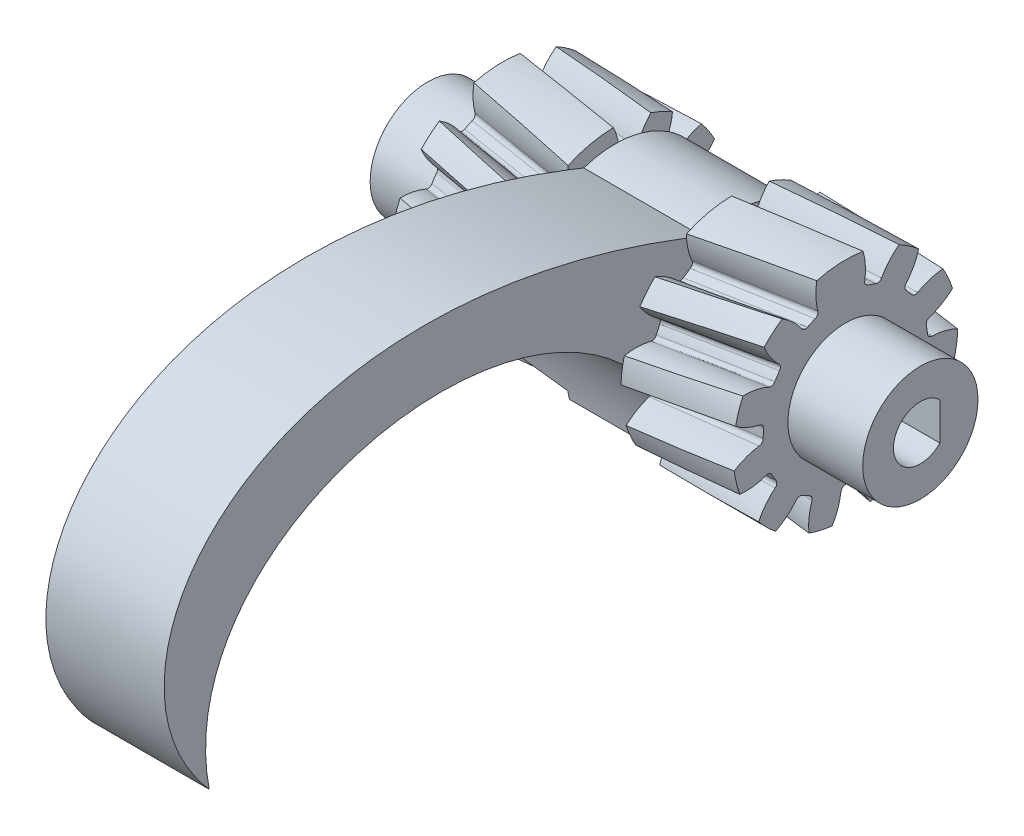
from build123d import *
from build123d.topology import SkipClean

# Parameters (mm, degrees)
CLAWSHAPE_DEPTH             = 3.75
GEARFILLET_R                = 0.3
GEARPATTERN_COUNT           = 11
GEARPATTERN_ANGLE           = 316.66666666700075
GEARFILLET_OF_GEARPATTERN_R = 0.3
SKETCH8_R                   = 3.85
BOSS_EXTRUDE1_DEPTH         = 5
BOSS_EXTRUDE2_DEPTH         = 3.95
CUT_EXTRUDE1_DEPTH          = 10
CUT_EXTRUDE1_DEPTH_BACK     = 49.25610305721891
CUT_EXTRUDE2_REACH          = 46.344


with BuildPart() as part:
    # Sketch1 → ClawShape (new, symmetric)
    with BuildSketch(Plane(origin=(0, 0, 0), x_dir=(0, 0, -1), z_dir=(1, 0, 0))):
        with BuildLine():
            ThreePointArc((-2.4038461538461515, 7.1043313315638), (-7.40042177807213, -1.218095852811159), (-1.38e-15, -7.500000000000001))
            ThreePointArc((0, -7.500000000000001), (5.303300858899106, -5.303300858899107), (7.499999999999999, -2.12e-15))
            ThreePointArc((7.499999999999999, -4.6e-16), (4.371564585257427, 6.094212260573391), (-2.4038461538461506, 7.104331331563799))
        make_face()
    extrude(amount=CLAWSHAPE_DEPTH, both=True)

    # Sketch6 for GearCut → GearCut section 0
    with BuildSketch(Plane(origin=(-3.75, 0, 0), x_dir=(0, -0.3216136511067725, -0.9468709835145288), z_dir=(1, 0, 0))):
        with BuildLine():
            # circular arc as an exact rational Bezier (weights 1, cos(half-angle), 1)
            Bezier((-0.5585419946678365, 5.471565666259748), (-0.732431488, 7.175014626), (-2.069978418155151, 8.244100275249684), weights=[1, 0.922077909565, 1])
            Bezier((-2.069978418155151, 8.244100275249684), (0, 8.763842941), (2.069978418155151, 8.244100275249684), weights=[1, 0.969894150029, 1])
            Bezier((2.069978418155151, 8.244100275249684), (0.732431488, 7.175014626), (0.5585419946678365, 5.471565666259748), weights=[1, 0.922077909565, 1])
            Bezier((0.5585419946678365, 5.471565666259748), (0, 5.5285821), (-0.5585419946678365, 5.471565666259748), weights=[1, 0.994830121138, 1])
        make_face()
    # Sketch5 for GearCut → GearCut section 1
    with BuildSketch(Plane(origin=(3.75, 0, 0), x_dir=(0, -0.1553907683686416, -0.9878530807290138), z_dir=(1, 0, 0))):
        with BuildLine():
            Bezier((-0.5585419946678365, 5.471565666259748), (-0.732431488, 7.175014626), (-2.069978418155151, 8.244100275249684), weights=[1, 0.922077909565, 1])
            Bezier((-2.069978418155151, 8.244100275249684), (0, 8.763842941), (2.069978418155151, 8.244100275249684), weights=[1, 0.969894150029, 1])
            Bezier((2.069978418155151, 8.244100275249684), (0.732431488, 7.175014626), (0.5585419946678365, 5.471565666259748), weights=[1, 0.922077909565, 1])
            Bezier((0.5585419946678365, 5.471565666259748), (0, 5.5285821), (-0.5585419946678365, 5.471565666259748), weights=[1, 0.994830121138, 1])
        make_face()
    gearcut = loft(mode=Mode.SUBTRACT)

    # GearFillet
    gearfillet_edges = [part.edges().sort_by_distance(p)[0] for p in [
        (0, 5.4261983817603285, -0.7646681831406935),
        (0, 5.159771381841158, -1.8452928211151451),
    ]]
    fillet(gearfillet_edges, radius=GEARFILLET_R)

    # GearPattern: GearCut ×11 about axis
    with SkipClean():  # the faces are left unmerged after this step: merging them gives an invalid solid
        gearpattern_axis = Axis((3.75, 0, 0), (-1, 0, 0))
        for i in range(1, GEARPATTERN_COUNT):
            add(gearcut.rotate(gearpattern_axis, i * GEARPATTERN_ANGLE / (GEARPATTERN_COUNT - 1)), mode=Mode.SUBTRACT)

    # GearFillet of GearPattern
    gearfillet_of_gearpattern_edges = [part.edges().sort_by_distance(p)[0] for p in [
        (0, 4.216895022789001, -3.4994489102290736),
        (0, 3.422831934100869, -4.2793186209285015),
        (0, 1.7519409378617308, -5.192210440532072),
        (0, 0.6666872702828095, -5.439106028766949),
        (4.4e-16, -1.2346827401120073, -5.33890483524436),
        (4.4e-16, -2.2879746320228533, -4.979309027540467),
        (4.4e-16, -3.8536590684200323, -3.8958513951266354),
        (4.4e-16, -4.561353981136529, -3.036839832341515),
        (4.4e-16, -5.3251442259262864, -1.292743316211702),
        (4.4e-16, -5.4765142124387225, -0.19010099811096337),
        (0, -5.210978999211674, 1.6953006159088706),
        (0, -4.760951124949681, 2.7132435744633154),
        (4.4e-16, -3.545157985966778, 4.178540554196175),
        (4.4e-16, -2.6277355457630898, 4.808674683325881),
        (0, -0.823707137345156, 5.417550448349581),
        (0, 0.28793205744268113, 5.472242816142476),
        (0, 2.1430162303676488, 5.043394466518253),
        (0, 3.1178630950000192, 4.50635950955569),
        (0, 4.471620823281842, 3.167483783907711),
        (0, 5.019398467616499, 2.1986326050104985),
    ]]
    fillet(gearfillet_of_gearpattern_edges, radius=GEARFILLET_OF_GEARPATTERN_R)

    # Sketch8 → Boss-Extrude1 (add)
    with BuildSketch(Plane.ZY.offset(3.75)):
        Circle(SKETCH8_R)
    extrude(amount=BOSS_EXTRUDE1_DEPTH)

    # Sketch9 → Boss-Extrude2 (add)
    with BuildSketch(Plane(origin=(3.75, 0, 0), x_dir=(0, 0, -1), z_dir=(1, 0, 0))):
        with BuildLine():
            Line((-35, -9.378221735089062), (0, -6.5))
            ThreePointArc((0, -6.5), (6.413698874329178, 1.0556830724363415), (-2.0833333333333326, 6.1570871540219585))
            add(Edge.make_bspline(
                [(-2.0833333333333326, 6.1570871540219585), (-31.74308973484289, 18.153235047904715), (-44.28474434105625, 1.1450513754499383), (-35, -9.378221735089062)],
                knots=[0, 0, 0, 0, 1, 1, 1, 1], degree=3))
        make_face()
    extrude(amount=BOSS_EXTRUDE2_DEPTH)

    # Mirror1: part across plane


with BuildPart() as part_1:
    add(part.part)
    add(part.part.mirror(Plane(origin=(7.7, 0, 0), x_dir=(0, 0, 1), z_dir=(1, 0, 0))))

    # Sketch10 → Cut-Extrude1 (cut, two sides: drawn at the far end of the back side and taken through both)
    with BuildSketch(Plane(origin=(19.15, 0, 0), x_dir=(0, 0, -1), z_dir=(1, 0, 0)).offset(-CUT_EXTRUDE1_DEPTH_BACK)):
        with BuildLine():
            Line((1.3, -1.2449899597988738), (1.3, 1.2449899597988738))
            ThreePointArc((1.3, 1.2449899597988738), (-1.8000000000000005, 2.2e-16), (1.3, -1.2449899597988738))
        make_face()
    extrude(amount=CUT_EXTRUDE1_DEPTH + CUT_EXTRUDE1_DEPTH_BACK, mode=Mode.SUBTRACT)

    # Sketch11 → Cut-Extrude2 (cut, up to next)
    with BuildSketch(Plane(origin=(11.65, 0, 0), x_dir=(0, 0, -1), z_dir=(1, 0, 0)), mode=Mode.PRIVATE) as cut_extrude2_sk1:
        with BuildLine():
            Line((-35, -9.378221735089062), (-3.042023925839187, -6.750160595459598))
            add(Edge.make_bspline(
                [(-35, -9.378221735089062), (-36.920588968414314, 0.645594803759232), (-28.84258623829141, 9.956319323182809), (-6.131083998682313, 9.943691241273234), (-3.042023925839187, -6.750160595459598)],
                knots=[0, 0, 0, 0, 0, 1, 1, 1, 1, 1], degree=4))
        make_face()
    cut_extrude2_tool1 = extrude(cut_extrude2_sk1.sketch, amount=-CUT_EXTRUDE2_REACH, mode=Mode.PRIVATE) & part_1.part
    add(cut_extrude2_tool1.solids().sort_by_distance((11.65, -2.137336, 20.013051))[0], mode=Mode.SUBTRACT)


solid = part_1.part
